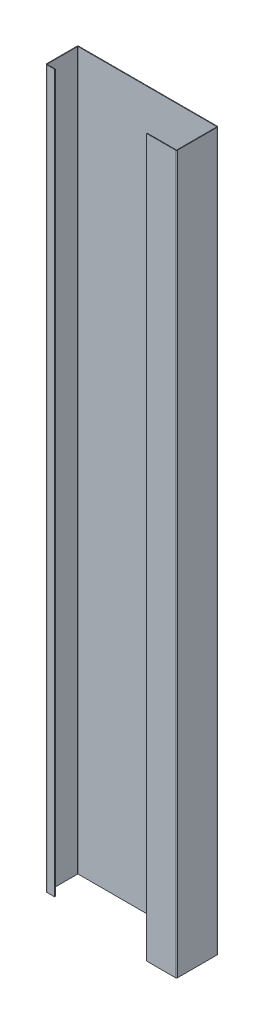
from build123d import *

# Parameters (mm, degrees)
SKETCH1_W                    = 235
SKETCH1_H                    = 1200
BASE_FLANGE1_DEPTH           = 1
EDGE_FLANGE2_STRIP_W         = 5.4732
EDGE_FLANGE2_STRIP_H         = 1
EDGE_FLANGE2_STRIP_CUT_DEPTH = 1200
EDGE_FLANGE2_DEPTH           = 1200
EDGE_FLANGE3_DEPTH           = 1200
EDGE_FLANGE4_STRIP_W         = 5.4732
EDGE_FLANGE4_STRIP_H         = 1
EDGE_FLANGE4_STRIP_CUT_DEPTH = 1200
EDGE_FLANGE4_DEPTH           = 1200
EDGE_FLANGE5_DEPTH           = 1200


# Sheet-metal steps are written as plain solids
with BuildPart() as part:
    # Sketch1 → Base-Flange1 (new body)
    with BuildSketch(Plane.XY):
        with Locations((-1020.895638629, 1263.161993769)):
            Rectangle(SKETCH1_W, SKETCH1_H)
    extrude(amount=-BASE_FLANGE1_DEPTH)

    # Edge-Flange2 strip (across the edge) → Edge-Flange2 strip cut (cut)
    with BuildSketch(Plane(origin=(-1138.395638629, 1863.161993769, 0), x_dir=(1, 0, 0), z_dir=(0, -1, 0))):
        with Locations((-1, -0.5)):
            Rectangle(EDGE_FLANGE2_STRIP_W, EDGE_FLANGE2_STRIP_H)
    extrude(amount=EDGE_FLANGE2_STRIP_CUT_DEPTH, mode=Mode.SUBTRACT)

    # Edge-Flange2 section (across the edge) → Edge-Flange2 (add)
    with BuildSketch(Plane(origin=(-1138.395638629, 1863.161993769, 0), x_dir=(1, 0, 0), z_dir=(0, -1, 0))):
        with BuildLine():
            Line((0, 0.7366), (0, 51))
            Line((0, 51), (1, 51))
            Line((1, 51), (1, 0.7366))
            ThreePointArc((1, 0.7366), (1.215745145, 0.215745145), (1.7366, 0))
            Line((1.7366, 0), (1.7366, -1))
            ThreePointArc((1.7366, -1), (0.508638364, -0.491361636), (0, 0.7366))
        make_face()
    extrude(amount=EDGE_FLANGE2_DEPTH)

    # Edge-Flange3 section (across the edge) → Edge-Flange3 (add)
    with BuildSketch(Plane(origin=(-1137.395638629, 1863.161993769, 51.7366), x_dir=(0, 0, -1), z_dir=(0, -1, 0))):
        with BuildLine():
            Line((-1, 0.7366), (-1, 14))
            Line((-1, 14), (0, 14))
            Line((0, 14), (0, 0.7366))
            ThreePointArc((0, 0.7366), (0.215745145, 0.215745145), (0.7366, 0))
            Line((0.7366, 0), (0.7366, -1))
            ThreePointArc((0.7366, -1), (-0.491361636, -0.491361636), (-1, 0.7366))
        make_face()
    extrude(amount=EDGE_FLANGE3_DEPTH)

    # Edge-Flange4 strip (across the edge) → Edge-Flange4 strip cut (cut)
    with BuildSketch(Plane(origin=(-903.395638629, 663.161993769, 0), x_dir=(-1, 0, 0), z_dir=(0, 1, 0))):
        with Locations((-1, -0.5)):
            Rectangle(EDGE_FLANGE4_STRIP_W, EDGE_FLANGE4_STRIP_H)
    extrude(amount=EDGE_FLANGE4_STRIP_CUT_DEPTH, mode=Mode.SUBTRACT)

    # Edge-Flange4 section (across the edge) → Edge-Flange4 (add)
    with BuildSketch(Plane(origin=(-903.395638629, 663.161993769, 0), x_dir=(-1, 0, 0), z_dir=(0, 1, 0))):
        with BuildLine():
            Line((0, 0.7366), (0, 67))
            Line((0, 67), (1, 67))
            Line((1, 67), (1, 0.7366))
            ThreePointArc((1, 0.7366), (1.215745145, 0.215745145), (1.7366, 0))
            Line((1.7366, 0), (1.7366, -1))
            ThreePointArc((1.7366, -1), (0.508638364, -0.491361636), (0, 0.7366))
        make_face()
    extrude(amount=EDGE_FLANGE4_DEPTH)

    # Edge-Flange5 section (across the edge) → Edge-Flange5 (add)
    with BuildSketch(Plane(origin=(-904.395638629, 663.161993769, 67.7366), x_dir=(0, 0, -1), z_dir=(0, 1, 0))):
        with BuildLine():
            Line((-1, 0.7366), (-1, 49))
            Line((-1, 49), (0, 49))
            Line((0, 49), (0, 0.7366))
            ThreePointArc((0, 0.7366), (0.215745145, 0.215745145), (0.7366, 0))
            Line((0.7366, 0), (0.7366, -1))
            ThreePointArc((0.7366, -1), (-0.491361636, -0.491361636), (-1, 0.7366))
        make_face()
    extrude(amount=EDGE_FLANGE5_DEPTH)


solid = part.part
